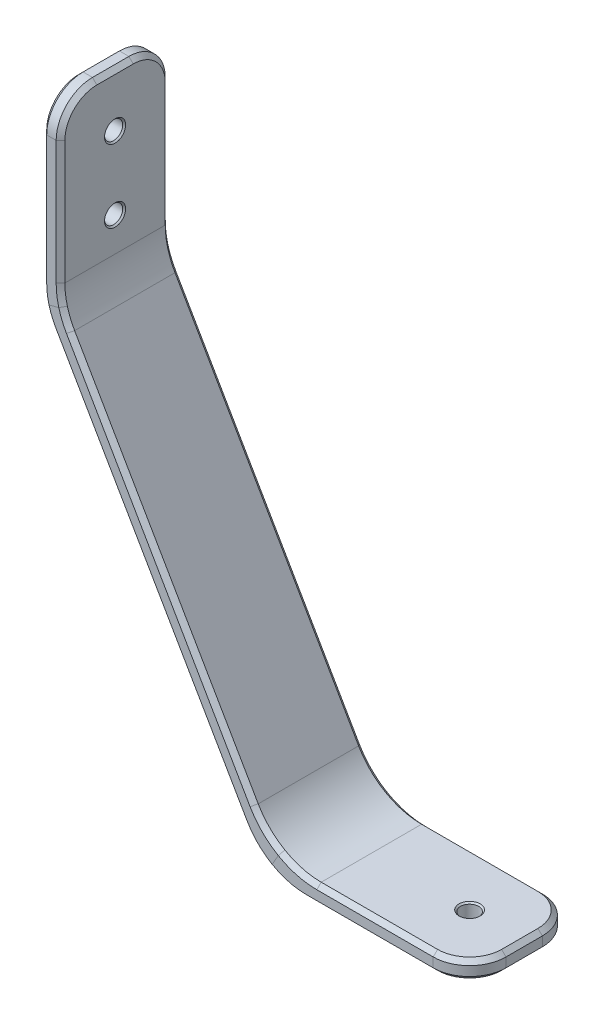
from build123d import *

# Parameters (mm, degrees)
SKETCH2_W                    = 3.175
SKETCH2_H                    = 19.05
F_1_8_0_125_DIAMETER_HOLE1_D = 3.175
F_1_8_0_125_DIAMETER_HOLE2_D = 3.175
FILLET1_R                    = 12.7
FILLET2_R                    = 6.35
CHAMFER3_SIZE                = 0.762
CHAMFER2_SIZE                = 0.254


with BuildPart() as part:
    # Sweep1: sweep along a path in Sketch1
    with BuildLine(Plane.XY) as sweep1_path:
        Line((0, 0), (0, -31.75))
        Line((0, -31.75), (38.1, -97.741135768))
        Line((38.1, -97.741135768), (73.025, -97.741135768))
    # Sketch2 → Sweep1 (sweep)
    with BuildSketch(Plane(origin=(0, 0, 0), x_dir=(1, 0, 0), z_dir=(0, 1, 0))):
        Rectangle(SKETCH2_W, SKETCH2_H)
    sweep(path=sweep1_path.line, transition=Transition.RIGHT)

    # 1/8 (0.125) Diameter Hole1 (through all)
    with Locations(Plane(origin=(1.5875, 0, 0), x_dir=(0, 0, -1), z_dir=(1, 0, 0))):
        with Locations((0, -9.312315329), (0, -22.012315329)):
            Hole(F_1_8_0_125_DIAMETER_HOLE1_D / 2)

    # 1/8 (0.125) Diameter Hole2 (through all)
    with Locations(Plane(origin=(0, -96.153635768, 0), x_dir=(1, 0, 0), z_dir=(0, 1, 0))):
        with Locations((63.5, 0)):
            Hole(F_1_8_0_125_DIAMETER_HOLE2_D / 2)

    # Fillet1
    fillet1_edges = [part.edges().sort_by_distance(p)[0] for p in [
        (-1.5875, -32.175369343, 0),
        (1.5875, -31.324630657, 0),
        (37.183456448, -99.328635768, 0),
        (39.016543552, -96.153635768, 0),
    ]]
    fillet(fillet1_edges, radius=FILLET1_R)

    # Fillet2
    fillet2_edges = [part.edges().sort_by_distance(p)[0] for p in [
        (73.025, -97.741135768, -9.525),
        (73.025, -97.741135768, 9.525),
        (0, 0, -9.525),
        (0, 0, 9.525),
    ]]
    fillet(fillet2_edges, radius=FILLET2_R)

    # Chamfer3
    chamfer3_edges = [part.edges().sort_by_distance(p)[0] for p in [
        (16.815629805, -64.050525184, -9.525),
        (-1.154757994, -32.059416472, -9.525),
        (38.165804866, -97.627158396, -9.525),
        (-1.154757994, -32.059416472, -9.525),
        (38.165804866, -97.627158396, -9.525),
        (-1.5875, -17.5612073, -9.525),
        (55.595402433, -99.328635768, -9.525),
        (-1.5875, -1.859871939, -7.665128061),
        (71.165128061, -99.328635768, -7.665128061),
        (-1.5875, 0, 0),
        (73.025, -99.328635768, 0),
        (-1.5875, -1.859871939, 7.665128061),
        (71.165128061, -99.328635768, 7.665128061),
        (-1.5875, -17.5612073, 9.525),
        (55.595402433, -99.328635768, 9.525),
        (-1.154757994, -32.059416472, 9.525),
        (38.165804866, -97.627158396, 9.525),
        (-1.154757994, -32.059416472, 9.525),
        (38.165804866, -97.627158396, 9.525),
        (16.815629805, -64.050525184, 9.525),
        (19.319673357, -62.037655841, -9.525),
        (2.020242006, -31.208677786, -9.525),
        (39.998891971, -94.452158396, -9.525),
        (2.020242006, -31.208677786, -9.525),
        (39.998891971, -94.452158396, -9.525),
        (1.5875, -17.135837957, -9.525),
        (56.511945986, -96.153635768, -9.525),
        (1.5875, -1.859871939, -7.665128061),
        (71.165128061, -96.153635768, -7.665128061),
        (1.5875, 0, 0),
        (73.025, -96.153635768, 0),
        (1.5875, -1.859871939, 7.665128061),
        (71.165128061, -96.153635768, 7.665128061),
        (1.5875, -17.135837957, 9.525),
        (56.511945986, -96.153635768, 9.525),
        (2.020242006, -31.208677786, 9.525),
        (39.998891971, -94.452158396, 9.525),
        (2.020242006, -31.208677786, 9.525),
        (39.998891971, -94.452158396, 9.525),
        (19.319673357, -62.037655841, 9.525),
    ]]
    chamfer(chamfer3_edges, length=CHAMFER3_SIZE)

    # Chamfer2
    chamfer2_edges = [part.edges().sort_by_distance(p)[0] for p in [
        (1.5875, -22.012315329, -1.5875),
        (-1.5875, -22.012315329, -1.5875),
        (1.5875, -9.312315329, -1.5875),
        (-1.5875, -9.312315329, -1.5875),
        (65.0875, -96.153635768, 0),
        (65.0875, -99.328635768, 0),
    ]]
    chamfer(chamfer2_edges, length=CHAMFER2_SIZE)


solid = part.part
